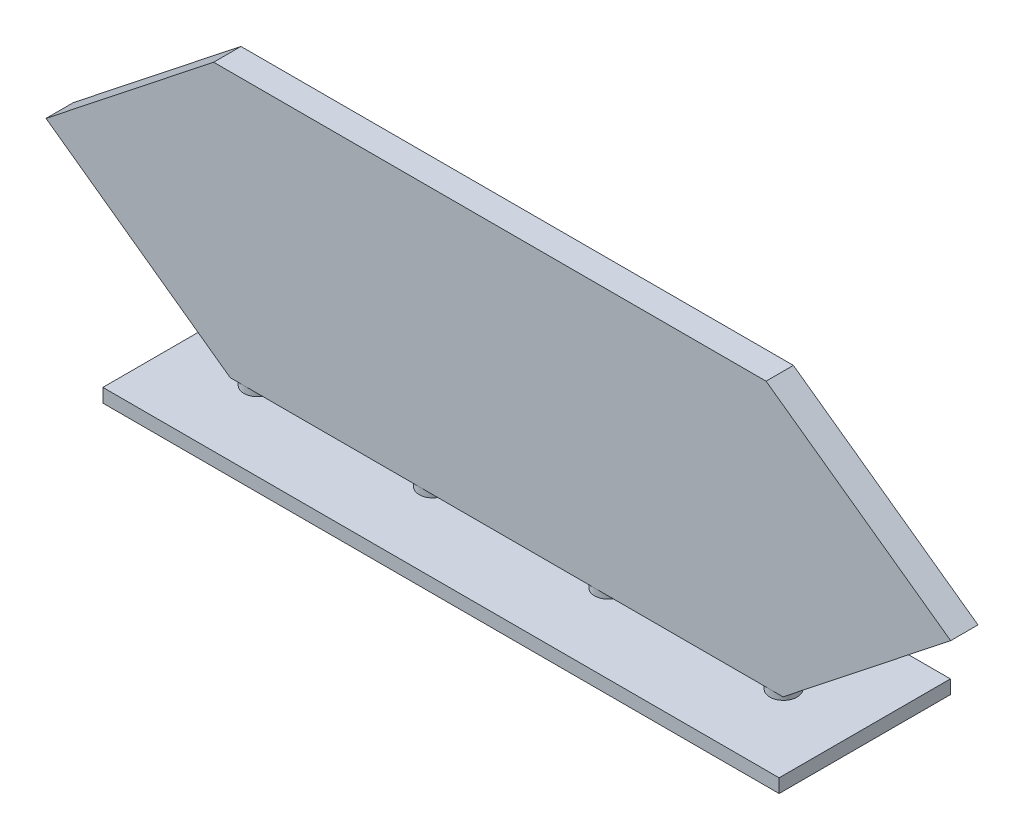
from build123d import *

# Parameters (mm, degrees)
EXTRUDE_1_DEPTH       = 1.2
CUT_EXTRUDE_1_DEPTH   = 1.2
CUT_EXTRUDE_1_2_DEPTH = 1.2
SKETCH_4_R            = 0.6
EXTRUDE_2_DEPTH       = 0.3
SKETCH_5_W            = 29.699213112
SKETCH_5_H            = 7.523800655
EXTRUDE_3_DEPTH       = 0.6


with BuildPart() as part:
    # Эскиз1 → Бобышка-Вытянуть1 (new body)
    with BuildSketch(Plane.XY):
        Polygon((-12.686954911, 6.182258949), (-20.530403447, -0.015033721), (-11.90549662, -6.217213911), (12.642254234, -6.217213911), (20.530403447, 0.015397813), (11.886622261, 6.217213911), (-13.761189247, 6.217213911), align=None)
    extrude(amount=EXTRUDE_1_DEPTH)

    # Эскиз2 → Cut-Extrude 1 (cut)
    with BuildSketch(Plane.XY.offset(1.2)):
        Polygon((-12.686954911, 6.182258949), (-13.761189247, 6.217213911), (-12.642715038, 6.217213911), align=None)
    extrude(amount=-CUT_EXTRUDE_1_DEPTH, mode=Mode.SUBTRACT)

    # Эскиз3 → Cut-Extrude 1 2 (cut)
    with BuildSketch(Plane.XY.offset(1.2)):
        Polygon((11.886622261, 6.217213911), (-12.642715038, 6.217213911), (-20.530403447, -0.015033721), (-11.90549662, -6.217213911), (12.642254234, -6.217213911), (20.530403447, 0.015397813), align=None)
        Polygon((11.757969034, 5.817213911), (-12.503760371, 5.817213911), (-19.866171727, 0), (-11.776608632, -5.817213911), (12.503299567, -5.817213911), (19.865710923, 0), align=None, mode=Mode.SUBTRACT)
    extrude(amount=-CUT_EXTRUDE_1_2_DEPTH, mode=Mode.SUBTRACT)

    # Эскиз4 → Бобышка-Вытянуть2 (add)
    with BuildSketch(Plane.XZ.offset(5.817213911)):
        with Locations((-11.176608632, 0.6)):
            Circle(SKETCH_4_R)
        with Locations((-3.476608632, 0.6)):
            Circle(SKETCH_4_R)
        with Locations((4.223391368, 0.6)):
            Circle(SKETCH_4_R)
        with Locations((11.923391368, 0.6)):
            Circle(SKETCH_4_R)
    extrude(amount=EXTRUDE_2_DEPTH)

    # Эскиз5 → Бобышка-Вытянуть3 (add)
    with BuildSketch(Plane.XZ.offset(6.117213911)):
        with Locations((0.346260417, 0.303007868)):
            Rectangle(SKETCH_5_W, SKETCH_5_H)
    extrude(amount=EXTRUDE_3_DEPTH)


solid = part.part
